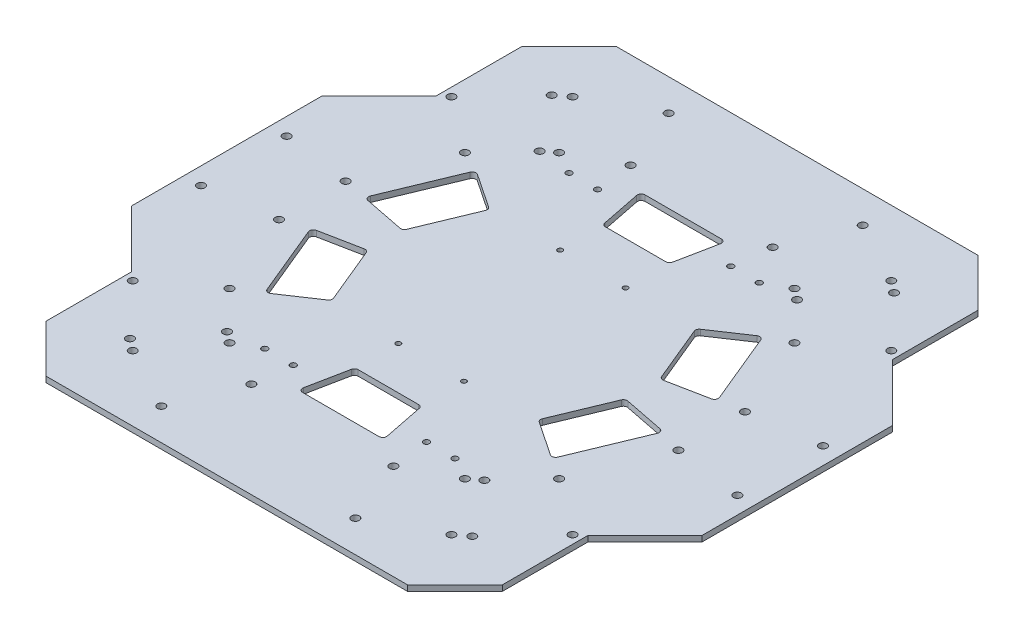
from build123d import *

# Parameters (mm, degrees)
BOSS_EXTRUDE1_DEPTH    = 3
SKETCH2_R              = 2.05
HEXCUT1_DEPTH          = 3
SKETCH5_R              = 1.55
CUT_EXTRUDE2_DEPTH     = 3
LPATTERN1_COUNT        = 2
LPATTERN1_PITCH        = 160
LPATTERN1_COUNT_DIR2   = 2
LPATTERN1_PITCH_DIR2   = 85
SKETCH6_R              = 2.05
QUADCUT1_DEPTH         = 3
SKETCH7_R              = 1.3
STDCARRIERCUBEFP_DEPTH = 3
CUT_EXTRUDE3_DEPTH     = 3
FILLET1_R              = 2
CIRPATTERN1_DEPTH      = 3
FILLET1_OF_MIRROR1_R   = 2


# Read off the part's stored shape, not the designer's step: CirPattern1
with BuildPart() as part:
    # Sketch1 → Boss-Extrude1 (new body)
    with BuildSketch(Plane(origin=(0, 0, 0), x_dir=(1, 0, 0), z_dir=(0, 1, 0))):
        Polygon((-95, 150), (-120, 125), (-120, 80), (-150, 50), (-150, -50), (-120, -80), (-120, -125), (-95, -150), (95, -150), (120, -125), (120, -80), (150, -50), (150, 50), (120, 80), (120, 125), (95, 150), align=None)
    extrude(amount=BOSS_EXTRUDE1_DEPTH)

    # Sketch2 → HexCut1 (cut)
    with BuildSketch(Plane(origin=(0, 3, 0), x_dir=(1, 0, 0), z_dir=(0, 1, 0))):
        with Locations(Location((51.014428415, 133.359581934, 0), (0, 0, 270))):
            Circle(SKETCH2_R)
        with Locations(Location((37.344555434, 99.682667397, 0), (0, 0, 270))):
            Circle(SKETCH2_R)
        with Locations(Location((37.344555434, -99.682667397, 0), (0, 0, 270))):
            Circle(SKETCH2_R)
        with Locations(Location((51.014428415, -133.359581934, 0), (0, 0, 270))):
            Circle(SKETCH2_R)
        with Locations(Location((105, 17.5, 0), (0, 0, 270))):
            Circle(SKETCH2_R)
        with Locations(Location((141, 22.5, 0), (0, 0, 270))):
            Circle(SKETCH2_R)
        with Locations(Location((105, -17.5, 0), (0, 0, 270))):
            Circle(SKETCH2_R)
        with Locations(Location((141, -22.5, 0), (0, 0, 270))):
            Circle(SKETCH2_R)
        with Locations(Location((89.985571585, -110.859581934, 0), (0, 0, 270))):
            Circle(SKETCH2_R)
        with Locations(Location((67.655444566, -82.182667397, 0), (0, 0, 270))):
            Circle(SKETCH2_R)
        with Locations(Location((89.985571585, 110.859581934, 0), (0, 0, 270))):
            Circle(SKETCH2_R)
        with Locations(Location((67.655444566, 82.182667397, 0), (0, 0, 270))):
            Circle(SKETCH2_R)
    hexcut1 = extrude(amount=-HEXCUT1_DEPTH, mode=Mode.SUBTRACT)

    # HexCut2: HexCut1 across plane
    add(hexcut1.mirror(Plane(origin=(0, 0, 0), x_dir=(0, 0, 1), z_dir=(1, 0, 0))), mode=Mode.SUBTRACT)

    # Sketch5 → Cut-Extrude2 (cut)
    with BuildSketch(Plane(origin=(0, 3, 0), x_dir=(1, 0, 0), z_dir=(0, 1, 0))):
        with Locations(Location((35, 80, 0), (0, 0, 270))):
            Circle(SKETCH5_R)
        with Locations(Location((50, 80, 0), (0, 0, 270))):
            Circle(SKETCH5_R)
    cut_extrude2 = extrude(amount=-CUT_EXTRUDE2_DEPTH, mode=Mode.SUBTRACT)

    # LPattern1: Cut-Extrude2 2 × 2
    with Locations(*[(-j * LPATTERN1_PITCH_DIR2, 0, i * LPATTERN1_PITCH) for i in range(LPATTERN1_COUNT) for j in range(LPATTERN1_COUNT_DIR2) if (i, j) != (0, 0)]):
        add(cut_extrude2, mode=Mode.SUBTRACT)

    # Sketch6 → QuadCut1 (cut)
    with BuildSketch(Plane(origin=(0, 3, 0), x_dir=(1, 0, 0), z_dir=(0, 1, 0))):
        with Locations(Location((86.620580695, 61.871843354, 0), (0, 0, 270))):
            Circle(SKETCH6_R)
        with Locations(Location((115.611958724, 83.792153571, 0), (0, 0, 270))):
            Circle(SKETCH6_R)
        with Locations(Location((83.792153571, 115.611958724, 0), (0, 0, 270))):
            Circle(SKETCH6_R)
        with Locations(Location((61.871843354, 86.620580695, 0), (0, 0, 270))):
            Circle(SKETCH6_R)
        with Locations(Location((86.620580695, -61.871843354, 0), (0, 0, 270))):
            Circle(SKETCH6_R)
        with Locations(Location((61.871843354, -86.620580695, 0), (0, 0, 270))):
            Circle(SKETCH6_R)
        with Locations(Location((83.792153571, -115.611958724, 0), (0, 0, 270))):
            Circle(SKETCH6_R)
        with Locations(Location((115.611958724, -83.792153571, 0), (0, 0, 270))):
            Circle(SKETCH6_R)
    quadcut1 = extrude(amount=-QUADCUT1_DEPTH, mode=Mode.SUBTRACT)

    # QuadCut2: QuadCut1 across plane
    add(quadcut1.mirror(Plane(origin=(0, 0, 0), x_dir=(0, 0, 1), z_dir=(1, 0, 0))), mode=Mode.SUBTRACT)

    # Sketch7 → StdCarrierCubeFP (cut)
    with BuildSketch(Plane(origin=(0, 3, 0), x_dir=(1, 0, 0), z_dir=(0, 1, 0))):
        with Locations(Location((-17.2, 42.5, 0), (0, 0, 270))):
            Circle(SKETCH7_R)
        with Locations(Location((17.2, 42.5, 0), (0, 0, 270))):
            Circle(SKETCH7_R)
        with Locations(Location((-17.2, -42.5, 0), (0, 0, 270))):
            Circle(SKETCH7_R)
        with Locations(Location((17.2, -42.5, 0), (0, 0, 270))):
            Circle(SKETCH7_R)
    extrude(amount=-STDCARRIERCUBEFP_DEPTH, mode=Mode.SUBTRACT)

    # Sketch8 → Cut-Extrude3 (cut)
    with BuildSketch(Plane(origin=(0, 3, 0), x_dir=(1, 0, 0), z_dir=(0, 1, 0))):
        Polygon((-17.5, -65), (17.5, -65), (22.5, -90), (-22.5, -90), align=None)
    cut_extrude3 = extrude(amount=-CUT_EXTRUDE3_DEPTH, mode=Mode.SUBTRACT)

    # Fillet1
    fillet1_edges = [part.edges().sort_by_distance(p)[0] for p in [
        (-22.5, 1.5, 90),
        (-17.5, 1.5, 65),
        (17.5, 1.5, 65),
        (22.5, 1.5, 90),
    ]]
    fillet(fillet1_edges, radius=FILLET1_R)

    # CirPattern1 outline → CirPattern1 (cut)
    with BuildSketch(Plane(origin=(0, 0, 0), x_dir=(1, 0, 0), z_dir=(0, 1, 0))):
        with BuildLine():
            ThreePointArc((54.915749171, -38.904044772), (54.849324183, -40.248979934), (55.650628912, -41.331187678))
            Line((55.650628912, -41.331187678), (73.444828679, -53.247833794))
            ThreePointArc((73.444828679, -53.247833794), (75.1372763, -53.500241806), (76.405467068, -52.351424618))
            Line((76.405467068, -52.351424618), (91.759026547, -15.284653092))
            ThreePointArc((91.759026547, -15.284653092), (91.67461668, -13.575570376), (90.299396073, -12.557308603))
            Line((90.299396073, -12.557308603), (69.290655474, -8.40125056))
            ThreePointArc((69.290655474, -8.40125056), (67.958811033, -8.599878987), (67.054767819, -9.59786132))
            Line((67.054767819, -9.59786132), (54.915749171, -38.904044772))
        make_face()
        with BuildLine():
            ThreePointArc((67.054767819, 11.617797575), (67.958811032, 10.619815242), (69.290655474, 10.421186816))
            Line((69.290655474, 10.421186816), (90.299396073, 14.577244859))
            ThreePointArc((90.299396073, 14.577244859), (91.67461668, 15.595506632), (91.759026547, 17.304589348))
            Line((91.759026547, 17.304589348), (76.405467068, 54.371360873))
            ThreePointArc((76.405467068, 54.371360873), (75.1372763, 55.520178061), (73.444828679, 55.267770049))
            Line((73.444828679, 55.267770049), (55.650628912, 43.351123933))
            ThreePointArc((55.650628912, 43.351123933), (54.849324183, 42.268916189), (54.915749171, 40.923981027))
            Line((54.915749171, 40.923981027), (67.054767819, 11.617797575))
        make_face()
        with BuildLine():
            ThreePointArc((-54.915749171, 40.923981027), (-54.849324183, 42.268916189), (-55.650628912, 43.351123933))
            Line((-55.650628912, 43.351123933), (-73.444828679, 55.267770049))
            ThreePointArc((-73.444828679, 55.267770049), (-75.1372763, 55.520178061), (-76.405467068, 54.371360873))
            Line((-76.405467068, 54.371360873), (-91.759026547, 17.304589348))
            ThreePointArc((-91.759026547, 17.304589348), (-91.67461668, 15.595506632), (-90.299396073, 14.577244859))
            Line((-90.299396073, 14.577244859), (-69.290655474, 10.421186816))
            ThreePointArc((-69.290655474, 10.421186816), (-67.958811032, 10.619815242), (-67.054767819, 11.617797575))
            Line((-67.054767819, 11.617797575), (-54.915749171, 40.923981027))
        make_face()
        with BuildLine():
            ThreePointArc((-67.054767819, -9.59786132), (-67.958811033, -8.599878987), (-69.290655474, -8.40125056))
            Line((-69.290655474, -8.40125056), (-90.299396073, -12.557308603))
            ThreePointArc((-90.299396073, -12.557308603), (-91.67461668, -13.575570376), (-91.759026547, -15.284653092))
            Line((-91.759026547, -15.284653092), (-76.405467068, -52.351424618))
            ThreePointArc((-76.405467068, -52.351424618), (-75.1372763, -53.500241806), (-73.444828679, -53.247833794))
            Line((-73.444828679, -53.247833794), (-55.650628912, -41.331187678))
            ThreePointArc((-55.650628912, -41.331187678), (-54.849324183, -40.248979934), (-54.915749171, -38.904044772))
            Line((-54.915749171, -38.904044772), (-67.054767819, -9.59786132))
        make_face()
    extrude(amount=CIRPATTERN1_DEPTH, mode=Mode.SUBTRACT)

    # Mirror1: Cut-Extrude3 across plane
    add(cut_extrude3.mirror(Plane.XY), mode=Mode.SUBTRACT)

    # Fillet1 of Mirror1
    fillet1_of_mirror1_edges = [part.edges().sort_by_distance(p)[0] for p in [
        (-22.5, 1.5, -90),
        (-17.5, 1.5, -65),
        (17.5, 1.5, -65),
        (22.5, 1.5, -90),
    ]]
    fillet(fillet1_of_mirror1_edges, radius=FILLET1_OF_MIRROR1_R)


solid = part.part
